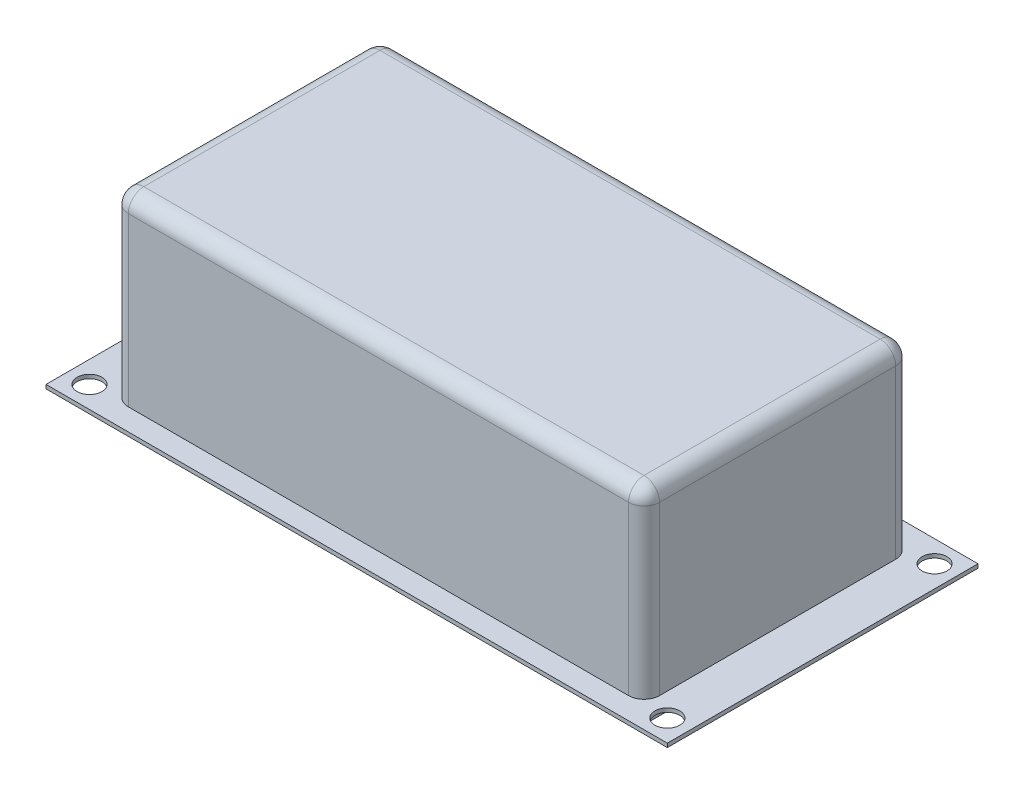
from build123d import *

# Parameters (mm, degrees)
SKETCH1_W               = 101.6
SKETCH1_H               = 50.8
BOSS_EXTRUDE1_DEPTH     = 0.3175
SKETCH2_R               = 2.032
CUT_EXTRUDE1_DEPTH      = 57.799676275
MIRROR2_COPY_1_SKETCH_R = 2.032
MIRROR2_COPY_1_DEPTH    = 57.799676275
MIRROR2_COPY_2_SKETCH_R = 2.032
MIRROR2_COPY_2_DEPTH    = 57.799676275
SKETCH3_W               = 86.868
SKETCH3_H               = 43.688
BOSS_EXTRUDE2_DEPTH     = 2.54
SKETCH3_2_W             = 86.868
SKETCH3_2_H             = 43.688
BOSS_EXTRUDE3_DEPTH     = 30.226
FILLET1_R               = 2.54


with BuildPart() as part:
    # Sketch1 → Boss-Extrude1 (new, symmetric)
    with BuildSketch(Plane(origin=(0, 0, 0), x_dir=(1, 0, 0), z_dir=(0, 1, 0))):
        Rectangle(SKETCH1_W, SKETCH1_H)
    extrude(amount=BOSS_EXTRUDE1_DEPTH, both=True)

    # Sketch2 → Cut-Extrude1 (cut, through all)
    with BuildSketch(Plane(origin=(0, 0.3175, 0), x_dir=(1, 0, 0), z_dir=(0, 1, 0))):
        with Locations((-47.244, -21.844)):
            Circle(SKETCH2_R)
    cut_extrude1 = extrude(amount=-CUT_EXTRUDE1_DEPTH, mode=Mode.SUBTRACT)

    # Mirror1: Cut-Extrude1 across plane
    add(cut_extrude1.mirror(Plane.XY), mode=Mode.SUBTRACT)

    # Mirror2 copy 1 sketch → Mirror2 copy 1 (cut, through all)
    with BuildSketch(Plane(origin=(0, 0.3175, 0), x_dir=(-1, 0, 0), z_dir=(0, 1, 0))):
        with Locations((-47.244, -21.844)):
            Circle(MIRROR2_COPY_1_SKETCH_R)
    extrude(amount=-MIRROR2_COPY_1_DEPTH, mode=Mode.SUBTRACT)

    # Mirror2 copy 2 sketch → Mirror2 copy 2 (cut, through all)
    with BuildSketch(Plane(origin=(0, 0.3175, 0), x_dir=(-1, 0, 0), z_dir=(0, 1, 0))):
        with Locations((-47.244, 21.844)):
            Circle(MIRROR2_COPY_2_SKETCH_R)
    extrude(amount=-MIRROR2_COPY_2_DEPTH, mode=Mode.SUBTRACT)

    # Sketch3 → Boss-Extrude2 (add)
    with BuildSketch(Plane(origin=(0, 0, 0), x_dir=(1, 0, 0), z_dir=(0, 1, 0))):
        Rectangle(SKETCH3_W, SKETCH3_H)
    extrude(amount=-BOSS_EXTRUDE2_DEPTH)

    # Sketch3<2> → Boss-Extrude3 (add)
    with BuildSketch(Plane(origin=(0, 0, 0), x_dir=(1, 0, 0), z_dir=(0, 1, 0))):
        Rectangle(SKETCH3_2_W, SKETCH3_2_H)
    extrude(amount=BOSS_EXTRUDE3_DEPTH)

    # Fillet1
    fillet1_edges = [part.edges().sort_by_distance(p)[0] for p in [
        (-43.434, 15.27175, -21.844),
        (0, 30.226, -21.844),
        (43.434, 15.27175, -21.844),
        (43.434, 30.226, 0),
        (43.434, 15.27175, 21.844),
        (0, 30.226, 21.844),
        (-43.434, 15.27175, 21.844),
        (-43.434, 30.226, 0),
    ]]
    fillet(fillet1_edges, radius=FILLET1_R)


solid = part.part
